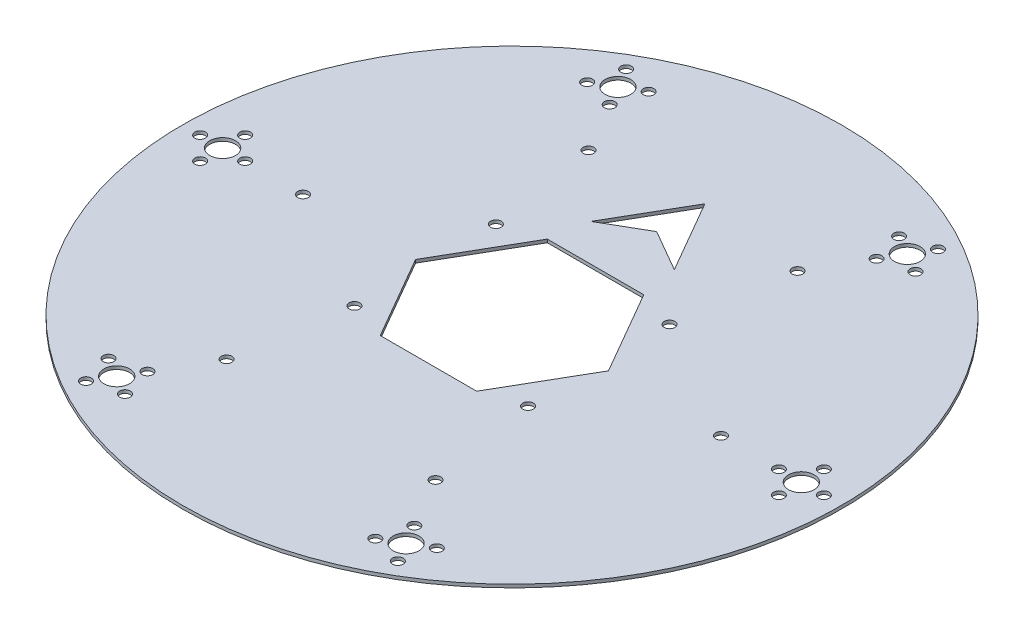
from build123d import *

# Parameters (mm, degrees)
SKETCH_1_R               = 102.5
SM_BASE_FLANGE_1_DEPTH   = 1
HOLE_WIZARD_8_0_8_1_D    = 8
PATTERN_CIRCULAR_1_COUNT = 6
HOLE_WIZARD_3_3_3_3_1_D  = 3.3
HOLE_WIZARD_3_3_3_3_2_D  = 3.3
HOLE_WIZARD_3_3_3_3_3_D  = 3.3


# Sheet-metal steps are written as plain solids
with BuildPart() as part:
    # Sketch 1 → 基体-法兰1 (new body)
    with BuildSketch(Plane(origin=(0, 0, 0), x_dir=(1, 0, 0), z_dir=(0, 1, 0))):
        with Locations(Location((0, 0, 0), (0, 0, 270))):
            Circle(SKETCH_1_R)
        Polygon((-12.990381057, 37.5), (0, 60), (12.990381057, 37.5), (0, 45), align=None, mode=Mode.SUBTRACT)
        Polygon((30, 0), (15, 25.980762114), (-15, 25.980762114), (-30, 0), (-15, -25.980762114), (15, -25.980762114), align=None, mode=Mode.SUBTRACT)
    extrude(amount=-SM_BASE_FLANGE_1_DEPTH)

    # Ø8.0 (8) 直径孔1 (through all)
    with Locations(Plane(origin=(0, 0, 0), x_dir=(1, 0, 0), z_dir=(0, 1, 0))):
        with Locations((-45, 77.942286341)):
            hole_wizard_8_0_8_1 = Hole(HOLE_WIZARD_8_0_8_1_D / 2)

    # 阵列(圆周)1: Ø8.0 (8) 直径孔1 ×6 about axis
    pattern_circular_1_axis = Axis((0, 0, 0), (0, 1, 0))
    for i in range(1, PATTERN_CIRCULAR_1_COUNT):
        add(hole_wizard_8_0_8_1.rotate(pattern_circular_1_axis, i * 360 / PATTERN_CIRCULAR_1_COUNT), mode=Mode.SUBTRACT)

    # Ø3.3 (3.3) 直径孔1 (through all)
    with Locations(Plane(origin=(0, 0, 0), x_dir=(1, 0, 0), z_dir=(0, 1, 0))):
        with Locations((-48.5, 84.004464167), (-51.062177826, 74.442286341), (-41.5, 71.880108514), (-38.937822174, 81.442286341), (48.5, 84.004464167), (38.937822174, 81.442286341), (51.062177826, 74.442286341), (41.5, 71.880108514), (90, 7), (90, -7), (97, 0), (83, 0), (-83, 0), (-97, 0), (-90, 7), (-90, -7), (-48.5, -84.004464167), (-38.937822174, -81.442286341), (-41.5, -71.880108514), (-51.062177826, -74.442286341), (51.062177826, -74.442286341), (41.5, -71.880108514), (38.937822174, -81.442286341), (48.5, -84.004464167)):
            Hole(HOLE_WIZARD_3_3_3_3_1_D / 2)

    # Ø3.3 (3.3) 直径孔2 (through all)
    with Locations(Plane(origin=(0, 0, 0), x_dir=(1, 0, 0), z_dir=(0, 1, 0))):
        with Locations((32.5, -56.291651246), (65, 0), (32.5, 56.291651246), (-32.5, 56.291651246), (-65, 0), (-32.5, -56.291651246)):
            Hole(HOLE_WIZARD_3_3_3_3_2_D / 2)

    # Ø3.3 (3.3) 直径孔3 (through all)
    with Locations(Plane(origin=(0, 0, 0), x_dir=(1, 0, 0), z_dir=(0, 1, 0))):
        with Locations((0, 0), (27, -22), (-27, 22), (-27, -22), (27, 22)):
            Hole(HOLE_WIZARD_3_3_3_3_3_D / 2)


solid = part.part
